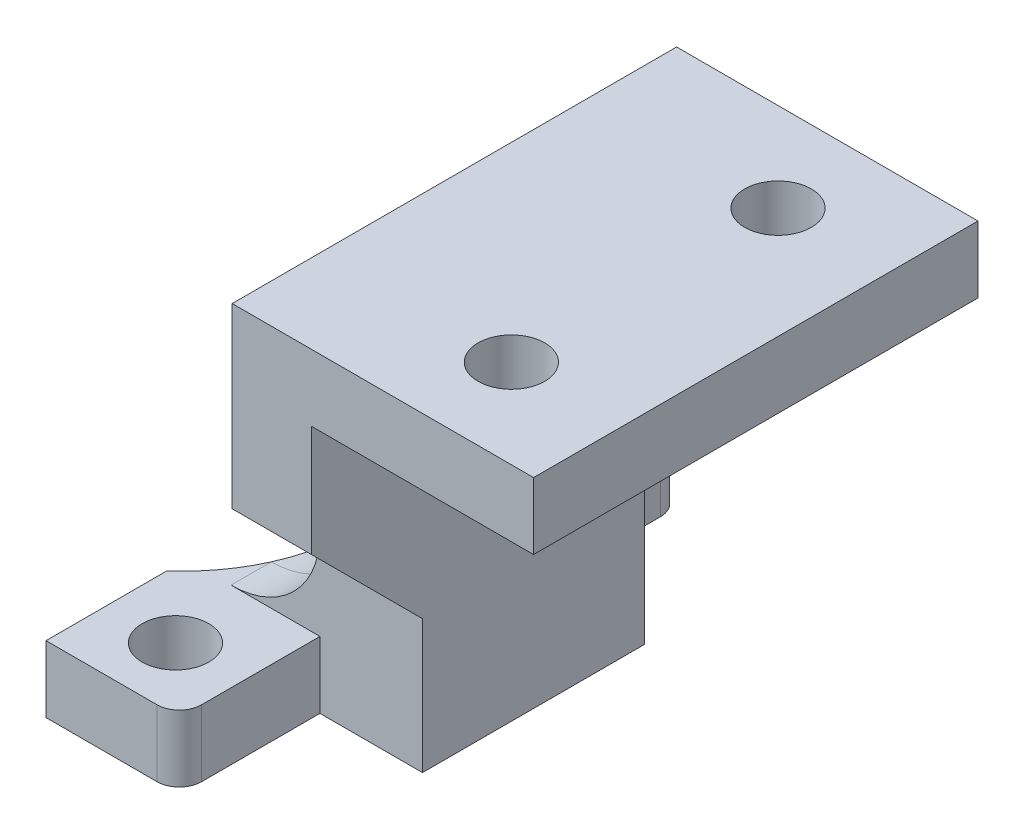
from build123d import *

# Parameters (mm, degrees)
SKETCH1_R           = 1.5
BOSS_EXTRUDE1_DEPTH = 3
SKETCH3_W           = 4.615398666
SKETCH3_H           = 10
BOSS_EXTRUDE2_DEPTH = 12.9997796
FILLET7_R           = 1
CUT_EXTRUDE4_DEPTH  = 10
SKETCH9_W           = 13.564457496
SKETCH9_H           = 20
SKETCH9_R           = 1.5
BOSS_EXTRUDE3_DEPTH = 3
CHAMFER1_SIZE       = 10
CHAMFER2_SIZE       = 10
FILLET8_R           = 4


with BuildPart() as part:
    # Sketch1 → Boss-Extrude1 (new body)
    with BuildSketch(Plane(origin=(0, 0, 0), x_dir=(1, 0, 0), z_dir=(0, 1, 0))):
        Polygon((-3, -11.32792047), (3, -11.32792047), (3, -5), (7.615398666, -5), (7.615398666, 5), (3, 5), (3, 11.32792047), (-3, 11.32792047), align=None)
        with Locations(Location((0, 8.5, 0), (0, 0, 270))):
            Circle(SKETCH1_R, mode=Mode.SUBTRACT)
        with Locations(Location((0, -8.5, 0), (0, 0, 270))):
            Circle(SKETCH1_R, mode=Mode.SUBTRACT)
    extrude(amount=BOSS_EXTRUDE1_DEPTH)

    # Sketch3 → Boss-Extrude2 (add)
    with BuildSketch(Plane(origin=(0, 3, 0), x_dir=(1, 0, 0), z_dir=(0, 1, 0))):
        with Locations((5.307699333, 0)):
            Rectangle(SKETCH3_W, SKETCH3_H)
    extrude(amount=BOSS_EXTRUDE2_DEPTH)

    # Fillet7
    fillet7_edges = [part.edges().sort_by_distance(p)[0] for p in [
        (3, 1.5, 11.32792047),
        (3, 1.5, -11.32792047),
    ]]
    fillet(fillet7_edges, radius=FILLET7_R)

    # Sketch7 → Cut-Extrude4 (cut)
    with BuildSketch(Plane.XZ):
        with BuildLine():
            Line((-3.65526474, -6.392053518), (-3.78188192, 6.478485425))
            ThreePointArc((-3.78188192, 6.478485425), (-0.319780446, 0.076652438), (-3.65526474, -6.392053518))
        make_face()
    extrude(amount=-CUT_EXTRUDE4_DEPTH, mode=Mode.SUBTRACT)

    # Sketch9 → Boss-Extrude3 (add)
    with BuildSketch(Plane(origin=(0, 15.9997796, 0), x_dir=(1, 0, 0), z_dir=(0, 1, 0))):
        with Locations((10.833169918, 0)):
            Rectangle(SKETCH9_W, SKETCH9_H)
        with Locations(Location((12.615398666, 6, 0), (0, 0, 270))):
            Circle(SKETCH9_R, mode=Mode.SUBTRACT)
        with Locations(Location((12.615398666, -6, 0), (0, 0, 270))):
            Circle(SKETCH9_R, mode=Mode.SUBTRACT)
    extrude(amount=BOSS_EXTRUDE3_DEPTH)

    # Chamfer1
    # the kernel refuses this chamfer: 10 mm, written as the material it adds along each edge
    with BuildSketch(Plane(origin=(4.05094117, 15.9997796, 5), x_dir=(0, -0.9996219169112968, -0.027495876610586403), z_dir=(1, 0, 0))) as chamfer1_piece_1_section:
        Polygon((CHAMFER1_SIZE * 0.999621916911, -CHAMFER1_SIZE * 0.0274958766106), (-CHAMFER1_SIZE * 0.0274958766106, -CHAMFER1_SIZE * 0.999621916911), (0, 0), align=None)
    chamfer1_piece_1 = extrude(amount=3.564457497, mode=Mode.PRIVATE)
    chamfer1_piece_1 = split(chamfer1_piece_1, bisect_by=Plane(origin=(5.833169918, 12.110890711, 10), z_dir=(0, 0, -1)), keep=Keep.TOP, mode=Mode.PRIVATE)
    add(chamfer1_piece_1)

    # Chamfer2
    # the kernel refuses this chamfer: 10 mm, written as the material it adds along each edge
    with BuildSketch(Plane(origin=(7.615398666, 15.9997796, -5), x_dir=(0, -0.9996219169112968, 0.027495876610586403), z_dir=(-1, 0, 0))) as chamfer2_piece_1_section:
        Polygon((CHAMFER2_SIZE * 0.999621916911, -CHAMFER2_SIZE * 0.0274958766106), (-CHAMFER2_SIZE * 0.0274958766106, -CHAMFER2_SIZE * 0.999621916911), (0, 0), align=None)
    chamfer2_piece_1 = extrude(amount=3.564457497, mode=Mode.PRIVATE)
    chamfer2_piece_1 = split(chamfer2_piece_1, bisect_by=Plane(origin=(5.833169918, 12.110890711, -10), z_dir=(0, 0, 1)), keep=Keep.TOP, mode=Mode.PRIVATE)
    add(chamfer2_piece_1)

    # Fillet8
    fillet8_edges = [part.edges().sort_by_distance(p)[0] for p in [
        (3, 3, 0),
    ]]
    fillet(fillet8_edges, radius=FILLET8_R)


solid = part.part
